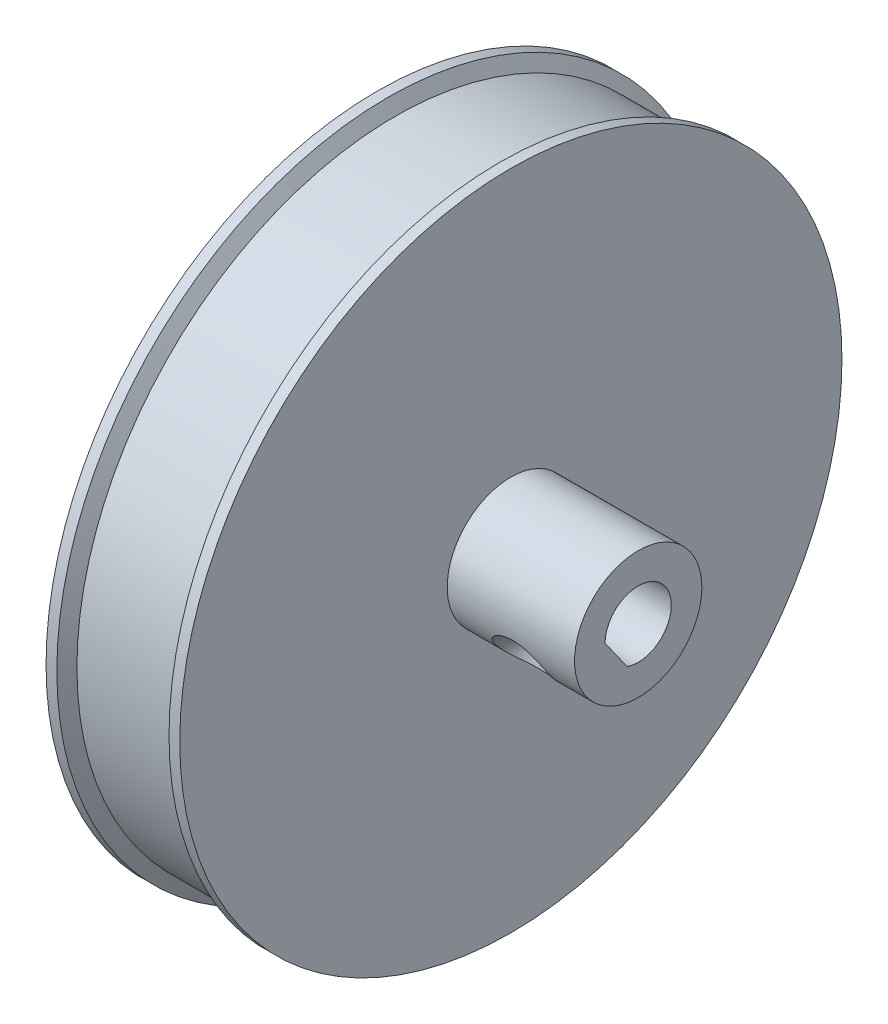
from build123d import *

# Parameters (mm, degrees)
SKETCH1_R                                       = 25
BOSS_EXTRUDE1_DEPTH                             = 3.25
SKETCH2_R                                       = 26
BOSS_EXTRUDE2_DEPTH                             = 2
CUT_EXTRUDE1_DEPTH                              = 38.739236876
BOSS_EXTRUDE3_START                             = 10
SKETCH6_R                                       = 5
BOSS_EXTRUDE3_DEPTH                             = 10
CSK_FOR_M2_FLAT_HEAD_MACHINE_SCREW1_D           = 1.6
CSK_FOR_M2_FLAT_HEAD_MACHINE_SCREW1_DEPTH       = 5
CSK_FOR_M2_FLAT_HEAD_MACHINE_SCREW1_CSINK_D     = 4.4
CSK_FOR_M2_FLAT_HEAD_MACHINE_SCREW1_CSINK_ANGLE = 90
CSK_FOR_M2_FLAT_HEAD_MACHINE_SCREW1_TIP         = 0.480688495
CHAMFER3_SIZE                                   = 1.154700538
CHAMFER3_SIZE_2                                 = 2
CUT_EXTRUDE2_DEPTH                              = 10


# Read off the part's stored shape, not the designer's step: Mirror6
with BuildPart() as part:
    # Sketch1 → Boss-Extrude1 (new, symmetric)
    with BuildSketch(Plane(origin=(0, 0, 0), x_dir=(0, 0, -1), z_dir=(1, 0, 0))):
        Circle(SKETCH1_R)
    extrude(amount=BOSS_EXTRUDE1_DEPTH, both=True)

    # Sketch2 → Boss-Extrude2 (add)
    with BuildSketch(Plane(origin=(3.25, 0, 0), x_dir=(0, 0, -1), z_dir=(1, 0, 0))):
        Circle(SKETCH2_R)
    extrude(amount=BOSS_EXTRUDE2_DEPTH)

    # Sketch3 → Cut-Extrude1 (cut, symmetric)
    with BuildSketch(Plane(origin=(5.25, 0, 0), x_dir=(0, 0, -1), z_dir=(1, 0, 0))):
        with BuildLine():
            Line((-0.869230769, -2.450395452), (-2.6, 0))
            ThreePointArc((-2.6, 0), (2.123676058, 1.5), (-0.869230769, -2.450395452))
        make_face()
    extrude(amount=CUT_EXTRUDE1_DEPTH, both=True, mode=Mode.SUBTRACT)

    # Sketch6 → Boss-Extrude3 (add)
    with BuildSketch(Plane(origin=(5.25, 0, 0), x_dir=(0, 0, -1), z_dir=(1, 0, 0)).offset(BOSS_EXTRUDE3_START)):
        Circle(SKETCH6_R)
        with BuildLine():
            Line((-2.6, 0), (-0.869230769, -2.450395452))
            ThreePointArc((-0.869230769, -2.450395452), (2.123676058, 1.5), (-2.6, 0))
        make_face(mode=Mode.SUBTRACT)
    extrude(amount=-BOSS_EXTRUDE3_DEPTH)

    # CSK for M2 Flat Head Machine Screw1
    with Locations(Plane(origin=(0, -2.884615385, 4.08399242), x_dir=(0, -0.8167984839075115, -0.576923076923077), z_dir=(0, -0.576923076923077, 0.8167984839075115))):
        with Locations((0, 10.25)):
            CounterSinkHole(CSK_FOR_M2_FLAT_HEAD_MACHINE_SCREW1_D / 2, CSK_FOR_M2_FLAT_HEAD_MACHINE_SCREW1_CSINK_D / 2, depth=CSK_FOR_M2_FLAT_HEAD_MACHINE_SCREW1_DEPTH, counter_sink_angle=CSK_FOR_M2_FLAT_HEAD_MACHINE_SCREW1_CSINK_ANGLE)
            with Locations((0, 0, -(CSK_FOR_M2_FLAT_HEAD_MACHINE_SCREW1_DEPTH + CSK_FOR_M2_FLAT_HEAD_MACHINE_SCREW1_TIP / 2))):  # 118° drill point
                Cone(0, CSK_FOR_M2_FLAT_HEAD_MACHINE_SCREW1_D / 2, CSK_FOR_M2_FLAT_HEAD_MACHINE_SCREW1_TIP, mode=Mode.SUBTRACT)

    # Chamfer3
    # the kernel refuses this chamfer: 2, 1.154700538 mm, written as the material it takes off along each edge
    with BuildSketch(Plane(origin=(3.25, 0, 0), x_dir=(0, 0, -1), z_dir=(0, -1, 0))) as chamfer3_piece_1_section:
        Polygon((26, CHAMFER3_SIZE), (26 - CHAMFER3_SIZE_2, 0), (26, 0), align=None)
    chamfer3_piece_1 = revolve(axis=Axis((3.25, 0, 0), (1, 0, 0)), mode=Mode.PRIVATE)
    chamfer3_piece_1 = chamfer3_piece_1 - Plane(origin=(4.089516227, 0, 0), x_dir=(0, 0, -1), z_dir=(1, 0, 0)) * Cylinder(25, 105, mode=Mode.PRIVATE)
    add(chamfer3_piece_1, mode=Mode.SUBTRACT)

    # Mirror6 outline → Mirror6 (revolve)
    with BuildSketch(Plane.YX):
        Polygon((26, -5.25), (26, -4.404700538), (25, -3.827350269), (25, -3.25), (2.6, -3.25), (2.6, 3.25), (0, 3.25), (0, -5.25), align=None)
    revolve(axis=Axis((0, 0, 0), (1, 0, 0)))

    # Sketch12 → Cut-Extrude2 (cut)
    with BuildSketch(Plane(origin=(3.25, 0, 0), x_dir=(0, 0, -1), z_dir=(1, 0, 0))):
        with BuildLine():
            Line((-2.6, 0), (-0.869230769, -2.450395452))
            ThreePointArc((-0.869230769, -2.450395452), (2.123676058, 1.5), (-2.6, 0))
        make_face()
    extrude(amount=-CUT_EXTRUDE2_DEPTH, mode=Mode.SUBTRACT)


solid = part.part
